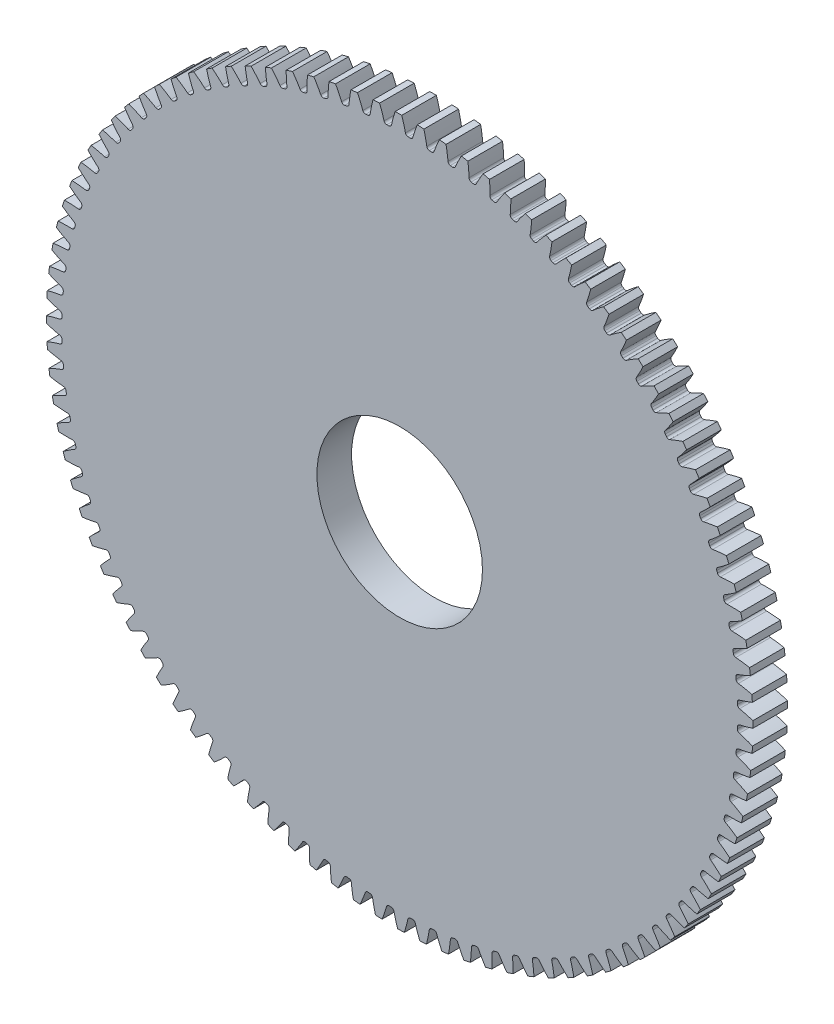
from build123d import *

# Parameters (mm, degrees)
SKETCH3_R         = 129.54
GEARBODY_DEPTH    = 12.7
TOOTHCUT_DEPTH    = 184.636905877
CIRPATTERN1_COUNT = 100
BOREDIA_R         = 30.353001332
BORE_DEPTH        = 12700


with BuildPart() as part:
    # Sketch3 → gearBody (new body)
    with BuildSketch(Plane.XY):
        Circle(SKETCH3_R)
    extrude(amount=GEARBODY_DEPTH)

    # Sketch2 → toothCut (cut, through all)
    with BuildSketch(Plane.XY):
        with BuildLine():
            ThreePointArc((123.841932578, -3.831852915), (123.853158303, -3.450005769), (123.863206665, -3.068125826))
            ThreePointArc((123.863206665, -3.068125826), (124.09092661, -2.455707871), (124.647152353, -2.112888604))
            ThreePointArc((124.647152353, -2.112888604), (141.910115277, 5.367293291), (155.226333036, 18.657942436))
            ThreePointArc((155.226333036, 18.657942436), (156.283017457, -4.353359407), (153.946977687, -27.270154835))
            ThreePointArc((153.946977687, -27.270154835), (141.391273248, -13.258827412), (124.571486449, -4.829249597))
            ThreePointArc((124.571486449, -4.829249597), (124.035207302, -4.455997935), (123.841932578, -3.831852915))
        make_face()
    toothcut = extrude(amount=TOOTHCUT_DEPTH, mode=Mode.SUBTRACT)

    # CirPattern1: toothCut ×100 about axis
    cirpattern1_axis = Axis((0, 0, 12.7), (0, 0, -1))
    for i in range(1, CIRPATTERN1_COUNT):
        add(toothcut.rotate(cirpattern1_axis, i * 360 / CIRPATTERN1_COUNT), mode=Mode.SUBTRACT)

    # boreDia → bore (cut, symmetric)
    with BuildSketch(Plane.XY):
        Circle(BOREDIA_R)
    extrude(amount=BORE_DEPTH, both=True, mode=Mode.SUBTRACT)


solid = part.part
